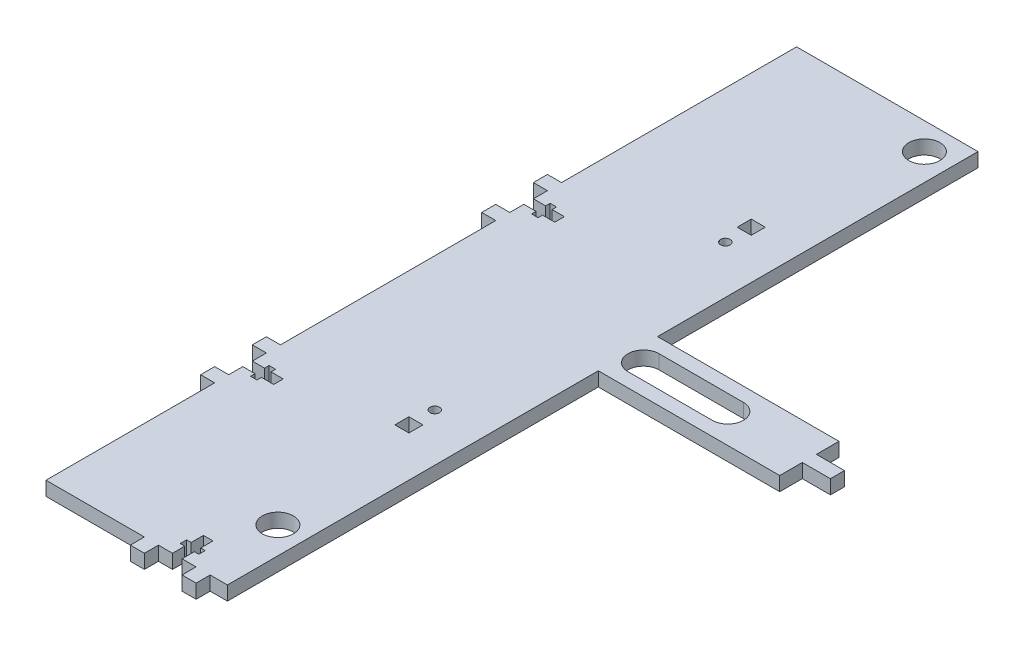
from build123d import *

# Parameters (mm, degrees)
AXLE_SUPPORT_PLATE_R   = 7.030128061
AXLE_SUPPORT_PLATE_W   = 6.35
AXLE_SUPPORT_PLATE_H   = 6.35
AXLE_SUPPORT_PLATE_R_2 = 2.159
BOSS_EXTRUDE1_DEPTH    = 6.35


with BuildPart() as part:
    # Axle Support Plate → Boss-Extrude1 (new body)
    with BuildSketch(Plane(origin=(0, 0, 0), x_dir=(1, 0, 0), z_dir=(0, 1, 0))):
        Polygon((29.718, -180.975), (37.510128061, -180.975), (37.510128061, -13.380128061), (119.470256121, -13.380128061), (119.470256121, -3.175), (132.170256121, -3.175), (132.170256121, 3.175), (119.470256121, 3.175), (119.470256121, 13.380128061), (37.510128061, 13.380128061), (37.510128061, 158.160128061), (-44.45, 158.160128061), (-44.45, 51.943), (-50.8, 51.943), (-50.8, 45.593), (-44.45, 45.593), (-44.45, 39.243), (-38.915000021, 39.243), (-38.915000021, 41.283999982), (-36.014999979, 41.283999982), (-36.014999979, 39.243), (-30.48, 39.243), (-30.48, 34.925), (-36.014999979, 34.925), (-36.014999979, 32.884000018), (-38.915000021, 32.884000018), (-38.915000021, 34.925), (-44.45, 34.925), (-44.45, 28.575), (-50.8, 28.575), (-50.8, 22.225), (-44.45, 22.225), (-44.45, -75.057), (-50.8, -75.057), (-50.8, -81.407), (-44.45, -81.407), (-44.45, -87.757), (-38.915000021, -87.757), (-38.915000021, -85.716000018), (-36.014999979, -85.716000018), (-36.014999979, -87.757), (-30.48, -87.757), (-30.48, -92.075), (-36.014999979, -92.075), (-36.014999979, -94.115999982), (-38.915000021, -94.115999982), (-38.915000021, -92.075), (-44.45, -92.075), (-44.45, -98.425), (-50.8, -98.425), (-50.8, -104.775), (-44.45, -104.775), (-44.45, -180.975), (0, -180.975), (0, -187.325), (6.35, -187.325), (6.35, -180.975), (12.7, -180.975), (12.7, -175.440000021), (10.659000018, -175.440000021), (10.659000018, -172.539999979), (12.7, -172.539999979), (12.7, -167.005), (17.018, -167.005), (17.018, -172.539999979), (19.058999982, -172.539999979), (19.058999982, -175.440000021), (17.018, -175.440000021), (17.018, -180.975), (23.368, -180.975), (23.368, -187.325), (29.718, -187.325), align=None)
        with Locations((25.4, -146.05)):
            Circle(AXLE_SUPPORT_PLATE_R, mode=Mode.SUBTRACT)
        with Locations((15.875, -77.343)):
            Rectangle(AXLE_SUPPORT_PLATE_W, AXLE_SUPPORT_PLATE_H, mode=Mode.SUBTRACT)
        with Locations((15.875, -65.659)):
            Circle(AXLE_SUPPORT_PLATE_R_2, mode=Mode.SUBTRACT)
        with Locations((15.875, 65.659)):
            Circle(AXLE_SUPPORT_PLATE_R_2, mode=Mode.SUBTRACT)
        with Locations((15.875, 77.343)):
            Rectangle(AXLE_SUPPORT_PLATE_W, AXLE_SUPPORT_PLATE_H, mode=Mode.SUBTRACT)
        with Locations((25.4, 146.05)):
            Circle(AXLE_SUPPORT_PLATE_R, mode=Mode.SUBTRACT)
        with BuildLine():
            ThreePointArc((44.540256121, -7.030128061), (37.510128061, 0), (44.540256121, 7.030128061))
            Line((44.540256121, 7.030128061), (82.640256121, 7.030128061))
            ThreePointArc((82.640256121, 7.030128061), (89.670384182, 0), (82.640256121, -7.030128061))
            Line((82.640256121, -7.030128061), (44.540256121, -7.030128061))
        make_face(mode=Mode.SUBTRACT)
    extrude(amount=BOSS_EXTRUDE1_DEPTH)


solid = part.part
